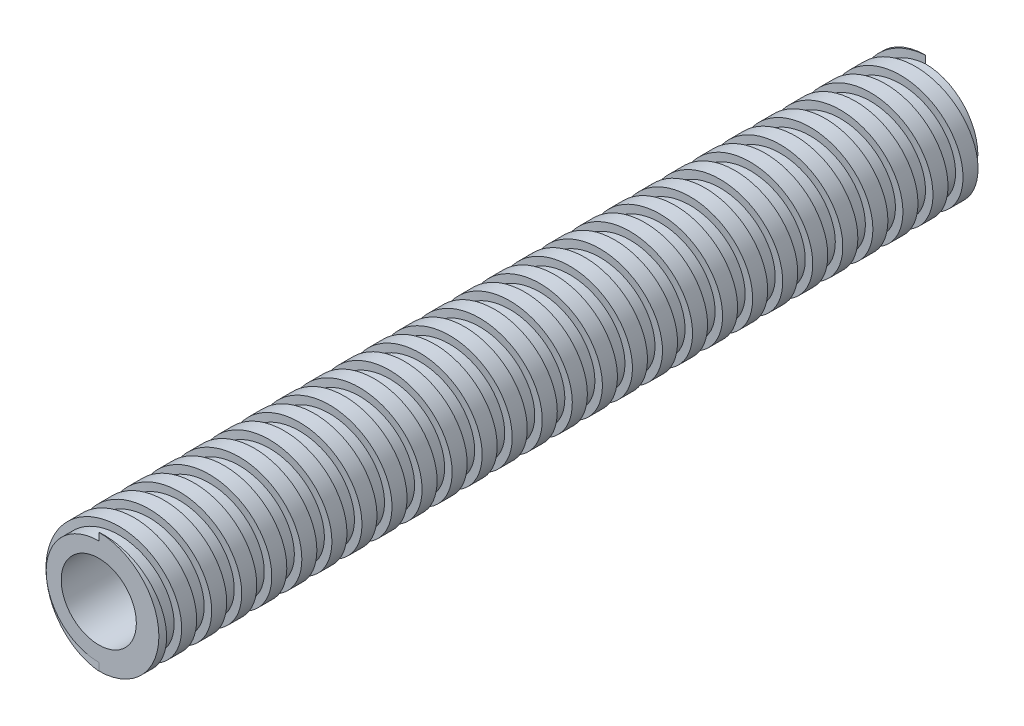
from build123d import *

# Parameters (mm, degrees)
SKETCH1_R           = 4
BOSS_EXTRUDE1_DEPTH = 55
CUT_SWEEP1_PITCH    = 2
SKETCH6_R           = 2.5
CUT_EXTRUDE1_DEPTH  = 10


with BuildPart() as part:
    # Sketch1 → Boss-Extrude1 (new body)
    with BuildSketch(Plane.XY):
        Circle(SKETCH1_R)
    extrude(amount=BOSS_EXTRUDE1_DEPTH)

    # Cut-Sweep1: arcs per turn and ends read off the stored shape
    # Cut-Sweep1: the profile of Sketch2 profile screwed along a right-hand helix through 29 turns, 10 arcs to a turn; built about Z, then put on its axis
    cut_sweep1_z = Axis((0, 0, 0), (0, 0, 1))
    cut_sweep1_corners = [(4.0003, 0, -1.5), (4.0003, 0, -2.5), (3.5, 0, -2.5), (3.5, 0, -1.5)]
    with BuildLine(mode=Mode.PRIVATE) as cut_sweep1_profile:
        Line(cut_sweep1_corners[0], cut_sweep1_corners[1])
        Line(cut_sweep1_corners[1], cut_sweep1_corners[2])
        Line(cut_sweep1_corners[2], cut_sweep1_corners[3])
        Line(cut_sweep1_corners[3], cut_sweep1_corners[0])
    cut_sweep1_cap = Face(cut_sweep1_profile.wire())
    cut_sweep1_turn_angles = [0, 18, 36, 54, 72, 90, 108, 126, 144, 162, 180, 198, 216, 234, 252, 270, 288, 306, 324, 342, 360]
    cut_sweep1_turn_weights = [1, 0.9510565162951535, 1, 0.9510565162951535, 1, 0.9510565162951535, 1, 0.9510565162951535, 1, 0.9510565162951535, 1, 0.9510565162951535, 1, 0.9510565162951535, 1, 0.9510565162951535, 1, 0.9510565162951535, 1, 0.9510565162951535, 1]
    cut_sweep1_turn_rails = [Edge.make_bspline([Vector(p[0], p[1], 0).rotate(cut_sweep1_z, cut_sweep1_turn_angles[k]) / cut_sweep1_turn_weights[k] + Vector(0, 0, p[2] + CUT_SWEEP1_PITCH * cut_sweep1_turn_angles[k] / 360) for k in range(21)], [0, 0, 0, 1, 1, 2, 2, 3, 3, 4, 4, 5, 5, 6, 6, 7, 7, 8, 8, 9, 9, 10, 10, 10], 2, cut_sweep1_turn_weights) for p in cut_sweep1_corners]
    cut_sweep1_turn_sides = [Face.make_surface_from_curves(cut_sweep1_turn_rails[p[0]], cut_sweep1_turn_rails[p[1]]) for p in [(0, 1), (1, 2), (2, 3), (3, 0)]]
    cut_sweep1 = Plane(origin=(0, 0, 0), x_dir=(1, 0, 0), z_dir=(0, 0, 1)) * Solid(Shell([*[p.moved(Location((0, 0, CUT_SWEEP1_PITCH * i))) for i in range(29) for p in cut_sweep1_turn_sides], cut_sweep1_cap, cut_sweep1_cap.rotate(cut_sweep1_z, 10440).moved(Location((0, 0, CUT_SWEEP1_PITCH * 10440 / 360)))]))
    add(cut_sweep1, mode=Mode.SUBTRACT)

    # Sketch6 → Cut-Extrude1 (cut)
    with BuildSketch(Plane.XY.offset(55)):
        Circle(SKETCH6_R)
    extrude(amount=-CUT_EXTRUDE1_DEPTH, mode=Mode.SUBTRACT)


solid = part.part
